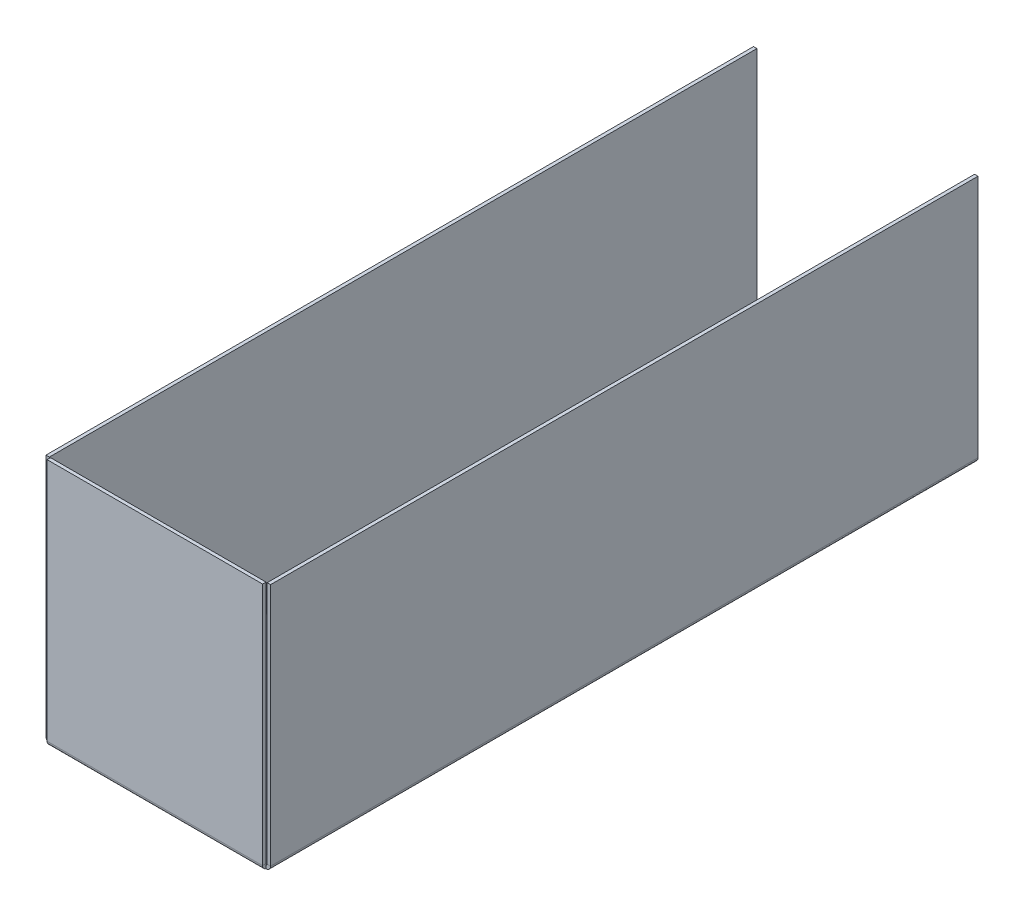
from build123d import *

# Parameters (mm, degrees)
BASE_FLANGE1_DEPTH           = 660.4
EDGE_FLANGE1_STRIP_W         = 14.7
EDGE_FLANGE1_STRIP_H         = 3.175
EDGE_FLANGE1_STRIP_CUT_DEPTH = 201.2
EDGE_FLANGE1_DEPTH           = 201.2


# Sheet-metal steps are written as plain solids
with BuildPart() as part:
    # Sketch1 → Base-Flange1 (new body)
    with BuildSketch(Plane.XY):
        with BuildLine():
            Line((-34.837852286, 228.6), (-34.837852286, 1))
            ThreePointArc((-34.837852286, 1), (-34.544959068, 0.292893219), (-33.837852286, 0))
            Line((-33.837852286, 0), (167.362147714, 0))
            ThreePointArc((167.362147714, 0), (168.069254495, 0.292893219), (168.362147714, 1))
            Line((168.362147714, 1), (168.362147714, 228.6))
            Line((168.362147714, 228.6), (171.537147714, 228.6))
            Line((171.537147714, 228.6), (171.537147714, 1))
            ThreePointArc((171.537147714, 1), (170.314318525, -1.952170811), (167.362147714, -3.175))
            Line((167.362147714, -3.175), (-33.837852286, -3.175))
            ThreePointArc((-33.837852286, -3.175), (-36.790023098, -1.952170811), (-38.012852286, 1))
            Line((-38.012852286, 1), (-38.012852286, 228.6))
            Line((-38.012852286, 228.6), (-34.837852286, 228.6))
        make_face()
    extrude(amount=BASE_FLANGE1_DEPTH)

    # Edge-Flange1 strip (across the edge) → Edge-Flange1 strip cut (cut)
    with BuildSketch(Plane(origin=(-33.837852286, 0, 660.4), x_dir=(0, 0, -1), z_dir=(1, 0, 0))):
        with Locations((-6.35, -1.5875)):
            Rectangle(EDGE_FLANGE1_STRIP_W, EDGE_FLANGE1_STRIP_H)
    extrude(amount=EDGE_FLANGE1_STRIP_CUT_DEPTH, mode=Mode.SUBTRACT)

    # Edge-Flange1 section (across the edge) → Edge-Flange1 (add)
    with BuildSketch(Plane(origin=(-33.837852286, 0, 660.4), x_dir=(0, 0, -1), z_dir=(1, 0, 0))):
        with BuildLine():
            Line((-3.175, 1), (-3.175, 228.6))
            Line((-3.175, 228.6), (0, 228.6))
            Line((0, 228.6), (0, 1))
            ThreePointArc((0, 1), (0.292893219, 0.292893219), (1, 0))
            Line((1, 0), (1, -3.175))
            ThreePointArc((1, -3.175), (-1.952170811, -1.952170811), (-3.175, 1))
        make_face()
    extrude(amount=EDGE_FLANGE1_DEPTH)


solid = part.part
